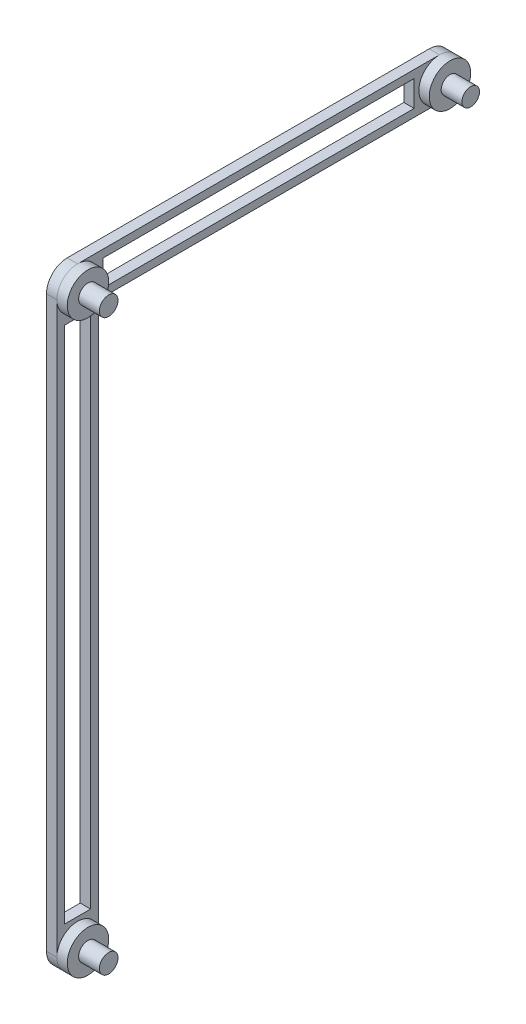
from build123d import *

# Parameters (mm, degrees)
SKETCH1_W           = 4
SKETCH1_H           = 54.9
SKETCH1_W_2         = 38.9
SKETCH1_H_2         = 4
BOSS_EXTRUDE1_DEPTH = 1
SKETCH2_R           = 2
BOSS_EXTRUDE2_DEPTH = 1
SKETCH3_R           = 0.9
SKETCH3_R_2         = 0.85
BOSS_EXTRUDE3_DEPTH = 2
SKETCH4_W           = 30
SKETCH4_H           = 2.5
SKETCH4_W_2         = 2.5
SKETCH4_H_2         = 50
CUT_EXTRUDE1_DEPTH  = 1
FILLET1_R           = 2


with BuildPart() as part:
    # Sketch1 → Boss-Extrude1 (new body)
    with BuildSketch(Plane(origin=(0, 0, 0), x_dir=(0, 0, -1), z_dir=(1, 0, 0))):
        with Locations((-17.45, -29.45)):
            Rectangle(SKETCH1_W, SKETCH1_H)
        Rectangle(SKETCH1_W_2, SKETCH1_H_2)
    extrude(amount=BOSS_EXTRUDE1_DEPTH)

    # Sketch2 → Boss-Extrude2 (add)
    with BuildSketch(Plane(origin=(1, 0, 0), x_dir=(0, 0, -1), z_dir=(1, 0, 0))):
        with Locations(Location((-17.45, 0, 0), (0, 0, 180))):
            Circle(SKETCH2_R)
        with Locations((17.45, 0)):
            Circle(SKETCH2_R)
        with Locations((-17.45, -54.9)):
            Circle(SKETCH2_R)
    extrude(amount=BOSS_EXTRUDE2_DEPTH)

    # Sketch3 → Boss-Extrude3 (add)
    with BuildSketch(Plane(origin=(2, 0, 0), x_dir=(0, 0, -1), z_dir=(1, 0, 0))):
        with Locations((-17.45, 0)):
            Circle(SKETCH3_R)
        with Locations((17.45, 0)):
            Circle(SKETCH3_R_2)
        with Locations((-17.45, -54.9)):
            Circle(SKETCH3_R)
    extrude(amount=BOSS_EXTRUDE3_DEPTH)

    # Sketch4 → Cut-Extrude1 (cut)
    with BuildSketch(Plane(origin=(1, 0, 0), x_dir=(0, 0, -1), z_dir=(1, 0, 0))):
        Rectangle(SKETCH4_W, SKETCH4_H)
        with Locations((-17.45, -27.5)):
            Rectangle(SKETCH4_W_2, SKETCH4_H_2)
    extrude(amount=-CUT_EXTRUDE1_DEPTH, mode=Mode.SUBTRACT)

    # Fillet1
    fillet1_edges = [part.edges().sort_by_distance(p)[0] for p in [
        (0.5, 2, 19.45),
        (0.5, 2, -19.45),
        (0.5, -2, -19.45),
        (0.5, -56.9, 15.45),
        (0.5, -56.9, 19.45),
    ]]
    fillet(fillet1_edges, radius=FILLET1_R - 0.0001)  # a hair under: the kernel refuses the full size


solid = part.part
